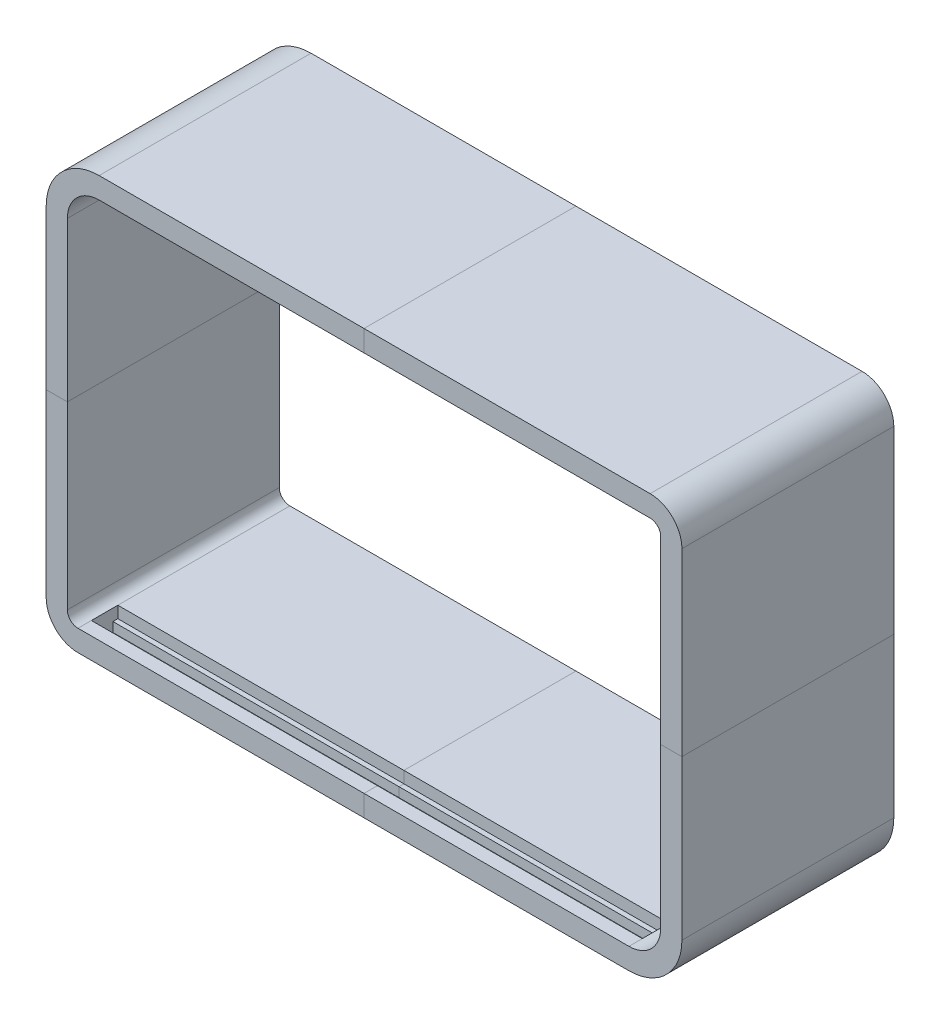
from build123d import *

# Parameters (mm, degrees)
SKETCH1_W           = 381
SKETCH1_H           = 254
BOSS_EXTRUDE1_DEPTH = 127
FILLET5_R           = 19.05
FILLET4_R           = 31.75
CUT_EXTRUDE1_DEPTH  = 262.817207227
CUT_EXTRUDE2_REACH  = 343.958
SKETCH5_W           = 330.2
SKETCH5_H           = 10.5
SKETCH13_W          = 330.2
SKETCH13_H          = 15.875
CUT_EXTRUDE6_DEPTH  = 7
SPLIT1_START        = -107.95
SPLIT1_OUTLINE_W    = 368.3
SPLIT1_OUTLINE_H    = 127
SPLIT1_DEPTH        = 234.95
SPLIT1_START_2      = -127
SPLIT1_2_DEPTH      = 19.05
SPLIT1_3_OUTLINE_W  = 12.7
SPLIT1_3_OUTLINE_H  = 127
SPLIT1_3_DEPTH      = 127
SPLIT1_4_DEPTH      = 103.1075
SPLIT1_START_3      = -23.8925
SPLIT1_5_DEPTH      = 23.8925
SPLIT1_START_4      = -8.0175
SPLIT1_6_OUTLINE_W  = 158.75
SPLIT1_6_OUTLINE_H  = 12.7
SPLIT1_6_DEPTH      = 8.0175
SPLIT1_7_OUTLINE_W  = 158.75
SPLIT1_7_OUTLINE_H  = 5.7
SPLIT1_7_DEPTH      = 2.9375
SPLIT1_START_5      = -10.455
SPLIT1_8_OUTLINE_W  = 158.75
SPLIT1_8_OUTLINE_H  = 5.7
SPLIT1_8_DEPTH      = 2.4375
SPLIT1_9_DEPTH      = 127
SPLIT1_10_DEPTH     = 127


# Read off the part's stored shape, not the designer's step: Split1
with BuildPart() as part:
    # Sketch1 → Boss-Extrude1 (new body)
    with BuildSketch(Plane.XY):
        Rectangle(SKETCH1_W, SKETCH1_H)
    extrude(amount=-BOSS_EXTRUDE1_DEPTH)

    # Fillet5
    fillet5_edges = [part.edges().sort_by_distance(p)[0] for p in [
        (-190.5, -127, -63.5),
        (190.5, 127, -63.5),
    ]]
    fillet(fillet5_edges, radius=FILLET5_R)

    # Fillet4
    fillet4_edges = [part.edges().sort_by_distance(p)[0] for p in [
        (190.5, -127, -63.5),
        (-190.5, 127, -63.5),
    ]]
    fillet(fillet4_edges, radius=FILLET4_R)

    # Sketch3 → Cut-Extrude1 (cut, through all)
    with BuildSketch(Plane(origin=(0, 0, 0), x_dir=(-1, 0, 0), z_dir=(0, 0, -1))):
        with BuildLine():
            Line((-158.75, -114.3), (171.45, -114.3))
            ThreePointArc((171.45, -114.3), (175.940128061, -112.440128061), (177.8, -107.95))
            Line((177.8, -107.95), (177.8, 95.25))
            ThreePointArc((177.8, 95.25), (172.220384182, 108.720384182), (158.75, 114.3))
            Line((158.75, 114.3), (-171.45, 114.3))
            ThreePointArc((-171.45, 114.3), (-175.940128061, 112.440128061), (-177.8, 107.95))
            Line((-177.8, 107.95), (-177.8, -95.25))
            ThreePointArc((-177.8, -95.25), (-172.220384182, -108.720384182), (-158.75, -114.3))
        make_face()
    extrude(amount=CUT_EXTRUDE1_DEPTH, mode=Mode.SUBTRACT)

    # Sketch5 → Cut-Extrude2 (cut, up to next)
    with BuildSketch(Plane.XZ.offset(127), mode=Mode.PRIVATE) as cut_extrude2_sk1:
        with Locations((-6.35, -15.705)):
            Rectangle(SKETCH5_W, SKETCH5_H)
    cut_extrude2_tool1 = extrude(cut_extrude2_sk1.sketch, amount=-CUT_EXTRUDE2_REACH, mode=Mode.PRIVATE) & part.part
    add(cut_extrude2_tool1.solids().sort_by_distance((-6.35, -127, -15.705))[0], mode=Mode.SUBTRACT)

    # Sketch13 → Cut-Extrude6 (cut)
    with BuildSketch(Plane(origin=(0, -114.3, 0), x_dir=(1, 0, 0), z_dir=(0, 1, 0))):
        with Locations((-6.35, 15.955)):
            Rectangle(SKETCH13_W, SKETCH13_H)
    extrude(amount=-CUT_EXTRUDE6_DEPTH, mode=Mode.SUBTRACT)

    # Split1 outline → Split1 (cut)
    with BuildSketch(Plane(origin=(0, 0, 0), x_dir=(1, 0, 0), z_dir=(0, 1, 0)).offset(SPLIT1_START)):
        with Locations((6.35, 63.5)):
            Rectangle(SPLIT1_OUTLINE_W, SPLIT1_OUTLINE_H)
    extrude(amount=SPLIT1_DEPTH, mode=Mode.SUBTRACT)

    # Split1 2 outline → Split1 2 (cut)
    with BuildSketch(Plane(origin=(0, 0, 0), x_dir=(1, 0, 0), z_dir=(0, 1, 0)).offset(SPLIT1_START_2)):
        Polygon((0, 0), (190.5, 0), (190.5, 127), (0, 127), (0, 20.955), (158.75, 20.955), (158.75, 10.455), (0, 10.455), align=None)
    extrude(amount=SPLIT1_2_DEPTH, mode=Mode.SUBTRACT)

    # Split1 3 outline → Split1 3 (cut)
    with BuildSketch(Plane(origin=(0, 0, 0), x_dir=(1, 0, 0), z_dir=(0, 1, 0))):
        with Locations((-184.15, 63.5)):
            Rectangle(SPLIT1_3_OUTLINE_W, SPLIT1_3_OUTLINE_H)
    extrude(amount=SPLIT1_3_DEPTH, mode=Mode.SUBTRACT)


with BuildPart() as body_2:
    # Split1 4 outline → Split1 4 (new body)
    with BuildSketch(Plane.XY.offset(SPLIT1_START_2)):
        with BuildLine():
            Line((0, -127), (158.75, -127))
            ThreePointArc((158.75, -127), (181.200640303, -117.700640303), (190.5, -95.25))
            Line((190.5, -95.25), (190.5, 0))
            Line((190.5, 0), (177.8, 0))
            Line((177.8, 0), (177.8, -95.25))
            ThreePointArc((177.8, -95.25), (172.220384182, -108.720384182), (158.75, -114.3))
            Line((158.75, -114.3), (0, -114.3))
            Line((0, -114.3), (0, -127))
        make_face()
    extrude(amount=SPLIT1_4_DEPTH)

    # Split1 5 outline → Split1 5 (add)
    with BuildSketch(Plane.XY.offset(SPLIT1_START_3)):
        with BuildLine():
            Line((158.75, -114.3), (158.75, -127))
            ThreePointArc((158.75, -127), (181.200640303, -117.700640303), (190.5, -95.25))
            Line((190.5, -95.25), (190.5, 0))
            Line((190.5, 0), (177.8, 0))
            Line((177.8, 0), (177.8, -95.25))
            ThreePointArc((177.8, -95.25), (172.220384182, -108.720384182), (158.75, -114.3))
        make_face()
    extrude(amount=SPLIT1_5_DEPTH)

    # Split1 6 outline → Split1 6 (add)
    with BuildSketch(Plane.XY.offset(SPLIT1_START_4)):
        with Locations((79.375, -120.65)):
            Rectangle(SPLIT1_6_OUTLINE_W, SPLIT1_6_OUTLINE_H)
    extrude(amount=SPLIT1_6_DEPTH)

    # Split1 7 outline → Split1 7 (add)
    with BuildSketch(Plane.XY.offset(SPLIT1_START_3)):
        with Locations((79.375, -124.15)):
            Rectangle(SPLIT1_7_OUTLINE_W, SPLIT1_7_OUTLINE_H)
    extrude(amount=SPLIT1_7_DEPTH)

    # Split1 8 outline → Split1 8 (add)
    with BuildSketch(Plane.XY.offset(SPLIT1_START_5)):
        with Locations((79.375, -124.15)):
            Rectangle(SPLIT1_8_OUTLINE_W, SPLIT1_8_OUTLINE_H)
    extrude(amount=SPLIT1_8_DEPTH)


with BuildPart() as body_3:
    # Split1 9 outline → Split1 9 (new body)
    with BuildSketch(Plane.XY.offset(SPLIT1_START_2)):
        with BuildLine():
            Line((0, 127), (0, 114.3))
            Line((0, 114.3), (171.45, 114.3))
            ThreePointArc((171.45, 114.3), (175.940128061, 112.440128061), (177.8, 107.95))
            Line((177.8, 107.95), (177.8, 0))
            Line((177.8, 0), (190.5, 0))
            Line((190.5, 0), (190.5, 107.95))
            ThreePointArc((190.5, 107.95), (184.920384182, 121.420384182), (171.45, 127))
            Line((171.45, 127), (0, 127))
        make_face()
    extrude(amount=SPLIT1_9_DEPTH)


with BuildPart() as body_4:
    # Split1 10 outline → Split1 10 (new body)
    with BuildSketch(Plane.XY.offset(SPLIT1_START_2)):
        with BuildLine():
            Line((-190.5, 0), (-177.8, 0))
            Line((-177.8, 0), (-177.8, 95.25))
            ThreePointArc((-177.8, 95.25), (-172.220384182, 108.720384182), (-158.75, 114.3))
            Line((-158.75, 114.3), (0, 114.3))
            Line((0, 114.3), (0, 127))
            Line((0, 127), (-158.75, 127))
            ThreePointArc((-158.75, 127), (-181.200640303, 117.700640303), (-190.5, 95.25))
            Line((-190.5, 95.25), (-190.5, 0))
        make_face()
    extrude(amount=SPLIT1_10_DEPTH)


solid = Compound([part.part, body_2.part, body_3.part, body_4.part])
